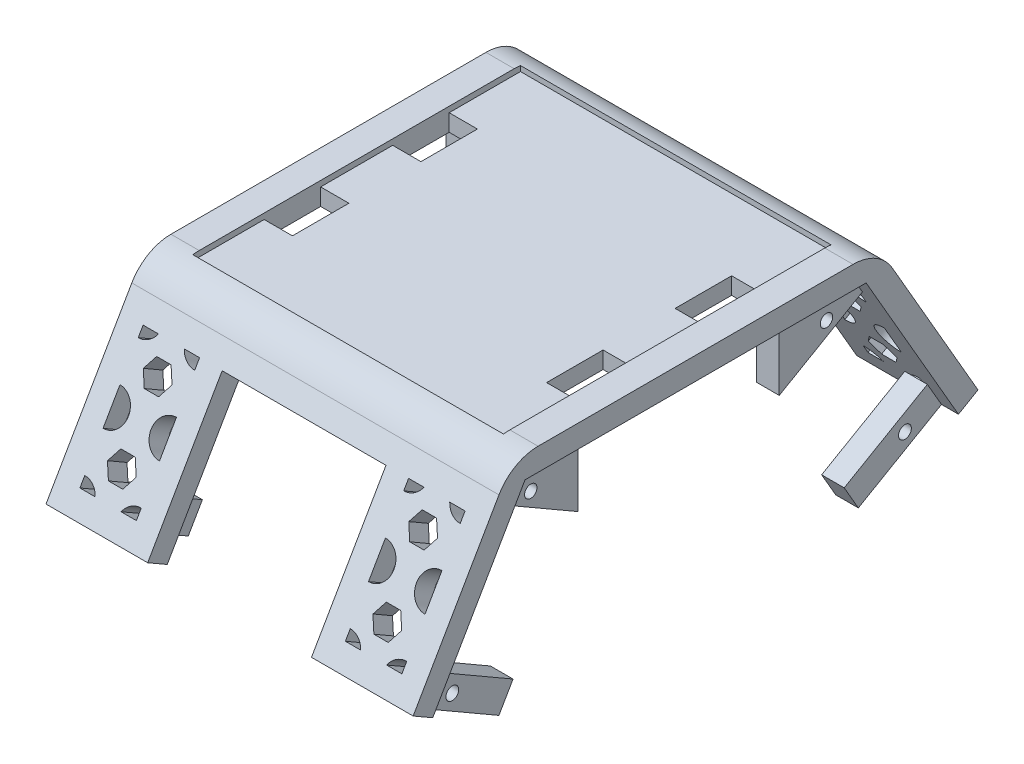
from build123d import *

# Parameters (mm, degrees)
SKETCH1_W               = 65
SKETCH1_H               = 65
BOSS_EXTRUDE1_DEPTH     = 4
SKETCH2_W               = 55
SKETCH2_H               = 58
CUT_EXTRUDE1_DEPTH      = 1
BOSS_EXTRUDE2_START     = -32.5
BOSS_EXTRUDE2_DEPTH     = 65
FILLET1_R               = 8
SKETCH4_W               = 29
SKETCH4_H               = 39.054095761
CUT_EXTRUDE2_DEPTH      = 94.438147744
BOSS_EXTRUDE3_START     = -3
BOSS_EXTRUDE3_DEPTH     = 4
CUT_EXTRUDE3_DEPTH      = 72.701861158
CUT_EXTRUDE3_DEPTH_BACK = 72.701861158
SKETCH6_W               = 5
SKETCH6_H               = 10
SKETCH7_R               = 1.136505642
SKETCH7_R_2             = 1.1
CUT_EXTRUDE4_DEPTH      = 88.744182478


with BuildPart() as part:
    # Sketch1 → Boss-Extrude1 (new body)
    with BuildSketch(Plane(origin=(0, 0, 0), x_dir=(1, 0, 0), z_dir=(0, 1, 0))):
        Rectangle(SKETCH1_W, SKETCH1_H)
    extrude(amount=BOSS_EXTRUDE1_DEPTH)

    # Sketch2 → Cut-Extrude1 (cut)
    with BuildSketch(Plane(origin=(0, 4, 0), x_dir=(1, 0, 0), z_dir=(0, 1, 0))):
        Rectangle(SKETCH2_W, SKETCH2_H)
    extrude(amount=-CUT_EXTRUDE1_DEPTH, mode=Mode.SUBTRACT)

    # Sketch3 → Boss-Extrude2 (add)
    with BuildSketch(Plane(origin=(0, 0, 0), x_dir=(0, 0, -1), z_dir=(1, 0, 0)).offset(BOSS_EXTRUDE2_START)):
        Polygon((-32.5, 4), (-50, -26.310889132), (-46.535898385, -28.310889132), (-29.035898385, 2), align=None)
        Polygon((32.5, 4), (50, -26.310889132), (46.535898385, -28.310889132), (29.035898385, 2), align=None)
    extrude(amount=BOSS_EXTRUDE2_DEPTH)

    # Fillet1
    # the kernel refuses this fillet: 8 mm, written as the material it takes off along each edge
    with BuildSketch(Plane(origin=(-44.047005384, 4, -32.5), x_dir=(0, 0, 1), z_dir=(1, 0, 0)), Plane(origin=(44.047005384, 4, 32.5), x_dir=(0, 0, -1), z_dir=(-1, 0, 0))) as fillet1_piece_1:
        with BuildLine():
            CenterArc((FILLET1_R * 0.57735026919, FILLET1_R), FILLET1_R, 210, 60)
            Line((-FILLET1_R * 0.288675134595, FILLET1_R * 0.5), (0, 0))
            Line((0, 0), (FILLET1_R * 0.57735026919, 0))
        make_face()
    extrude(amount=88.094010768, mode=Mode.SUBTRACT)

    # Sketch4 → Cut-Extrude2 (cut, symmetric)
    with BuildSketch(Plane(origin=(0, 15.072912811, 26.107050808), x_dir=(1, 0, 0), z_dir=(0, 0.5000000000000038, 0.8660254037844366))):
        with Locations((0, -40.931748419)):
            Rectangle(SKETCH4_W, SKETCH4_H)
        with BuildLine():
            Line((-28.5, -21.404700538), (-25.78436039, -21.404700538))
            ThreePointArc((-25.78436039, -21.404700538), (-26.891370055, -22.662081282), (-28.5, -23.129827404))
            Line((-28.5, -23.129827404), (-28.5, -21.404700538))
        make_face()
        with BuildLine():
            Line((-28.5, -43.785898385), (-25.78436039, -43.785898385))
            ThreePointArc((-25.78436039, -43.785898385), (-26.891370055, -42.528517641), (-28.5, -42.060771519))
            Line((-28.5, -42.060771519), (-28.5, -43.785898385))
        make_face()
        with BuildLine():
            Line((-18.5, -21.404700538), (-18.5, -23.129827404))
            ThreePointArc((-18.5, -23.129827404), (-20.108629945, -22.662081282), (-21.21563961, -21.404700538))
            Line((-21.21563961, -21.404700538), (-18.5, -21.404700538))
        make_face()
        with BuildLine():
            Line((-28.5, -29.595299462), (-28.5, -35.595299462))
            ThreePointArc((-28.5, -35.595299462), (-25.5, -32.595299462), (-28.5, -29.595299462))
        make_face()
        with BuildLine():
            Line((-21.21563961, -43.785898385), (-18.5, -43.785898385))
            Line((-18.5, -43.785898385), (-18.5, -42.060771519))
            ThreePointArc((-18.5, -42.060771519), (-20.108629945, -42.528517641), (-21.21563961, -43.785898385))
        make_face()
        with BuildLine():
            Line((-18.5, -29.595299462), (-18.5, -35.595299462))
            ThreePointArc((-18.5, -35.595299462), (-21.5, -32.595299462), (-18.5, -29.595299462))
        make_face()
        Polygon((-20.954371059, -26.250299462), (-22.22718553, -24.04572013), (-24.77281447, -24.04572013), (-26.045628941, -26.250299462), (-24.77281447, -28.454878793), (-22.22718553, -28.454878793), align=None)
        Polygon((-22.22718553, -36.73572013), (-20.954371059, -38.940299462), (-22.22718553, -41.144878793), (-24.77281447, -41.144878793), (-26.045628941, -38.940299462), (-24.77281447, -36.73572013), align=None)
        Polygon((20.954371059, -38.940299462), (22.22718553, -41.144878793), (24.77281447, -41.144878793), (26.045628941, -38.940299462), (24.77281447, -36.73572013), (22.22718553, -36.73572013), align=None)
        Polygon((22.22718553, -28.454878793), (20.954371059, -26.250299462), (22.22718553, -24.04572013), (24.77281447, -24.04572013), (26.045628941, -26.250299462), (24.77281447, -28.454878793), align=None)
        with BuildLine():
            Line((21.21563961, -21.404700538), (18.5, -21.404700538))
            Line((18.5, -21.404700538), (18.5, -23.129827404))
            ThreePointArc((18.5, -23.129827404), (20.108629945, -22.662081282), (21.21563961, -21.404700538))
        make_face()
        with BuildLine():
            Line((18.5, -29.595299462), (18.5, -35.595299462))
            ThreePointArc((18.5, -35.595299462), (21.5, -32.595299462), (18.5, -29.595299462))
        make_face()
        with BuildLine():
            Line((18.5, -42.060771519), (18.5, -43.785898385))
            Line((18.5, -43.785898385), (21.21563961, -43.785898385))
            ThreePointArc((21.21563961, -43.785898385), (20.108629945, -42.528517641), (18.5, -42.060771519))
        make_face()
        with BuildLine():
            Line((28.5, -42.060771519), (28.5, -43.785898385))
            Line((28.5, -43.785898385), (25.78436039, -43.785898385))
            ThreePointArc((25.78436039, -43.785898385), (26.891370055, -42.528517641), (28.5, -42.060771519))
        make_face()
        with BuildLine():
            Line((28.5, -29.595299462), (28.5, -35.595299462))
            ThreePointArc((28.5, -35.595299462), (25.5, -32.595299462), (28.5, -29.595299462))
        make_face()
        with BuildLine():
            Line((28.5, -21.404700538), (28.5, -23.129827404))
            ThreePointArc((28.5, -23.129827404), (26.891370055, -22.662081282), (25.78436039, -21.404700538))
            Line((25.78436039, -21.404700538), (28.5, -21.404700538))
        make_face()
    cut_extrude2 = extrude(amount=CUT_EXTRUDE2_DEPTH, both=True, mode=Mode.SUBTRACT)

    # Mirror1: Cut-Extrude2 across plane
    add(cut_extrude2.mirror(Plane.XY), mode=Mode.SUBTRACT)

    # Sketch5 → Boss-Extrude3 (add)
    with BuildSketch(Plane(origin=(32.5, 0, 0), x_dir=(0, 0, -1), z_dir=(1, 0, 0)).offset(BOSS_EXTRUDE3_START)):
        Polygon((-17.813466521, 0), (-30.190598923, 0), (-32.535898385, -4.062177826), (-17.813466521, -12.562177826), align=None)
        Polygon((17.813466521, -12.562177826), (32.535898385, -4.062177826), (30.190598923, 0), (17.813466521, 0), align=None)
        Polygon((-46.535898385, -28.310889132), (-44.035898385, -23.980762114), (-29.313466521, -32.480762114), (-31.813466521, -36.810889132), align=None)
        Polygon((44.035898385, -23.980762114), (29.313466521, -32.480762114), (31.813466521, -36.810889132), (46.535898385, -28.310889132), align=None)
    boss_extrude3 = extrude(amount=-BOSS_EXTRUDE3_DEPTH)

    # Mirror2: Boss-Extrude3 across plane
    add(boss_extrude3.mirror(Plane(origin=(0, 0, 0), x_dir=(0, 0, 1), z_dir=(1, 0, 0))))

    # Sketch6 → Cut-Extrude3 (cut, two sides: drawn at the far end of the back side and taken through both)
    with BuildSketch(Plane(origin=(0, 3, 0), x_dir=(1, 0, 0), z_dir=(0, 1, 0)).offset(-CUT_EXTRUDE3_DEPTH_BACK)):
        with Locations((-25, 11.375342453)):
            Rectangle(SKETCH6_W, SKETCH6_H)
        with Locations((25, 11.375342453)):
            Rectangle(SKETCH6_W, SKETCH6_H)
        with Locations((25, -11.375342453)):
            Rectangle(SKETCH6_W, SKETCH6_H)
        with Locations((-25, -11.375342453)):
            Rectangle(SKETCH6_W, SKETCH6_H)
    extrude(amount=CUT_EXTRUDE3_DEPTH + CUT_EXTRUDE3_DEPTH_BACK, mode=Mode.SUBTRACT)

    # Sketch7 → Cut-Extrude4 (cut, symmetric)
    with BuildSketch(Plane(origin=(29.5, 0, 0), x_dir=(0, 0, -1), z_dir=(1, 0, 0))):
        with Locations(Location((-40.068359478, -29.290559327, 0), (0, 0, 180))):
            Circle(SKETCH7_R)
        with Locations((-26.178143422, -5.250223208)):
            Circle(SKETCH7_R_2)
    cut_extrude4 = extrude(amount=CUT_EXTRUDE4_DEPTH, both=True, mode=Mode.SUBTRACT)

    # Mirror3: Cut-Extrude4 across plane
    add(cut_extrude4.mirror(Plane.XY), mode=Mode.SUBTRACT)


solid = part.part
